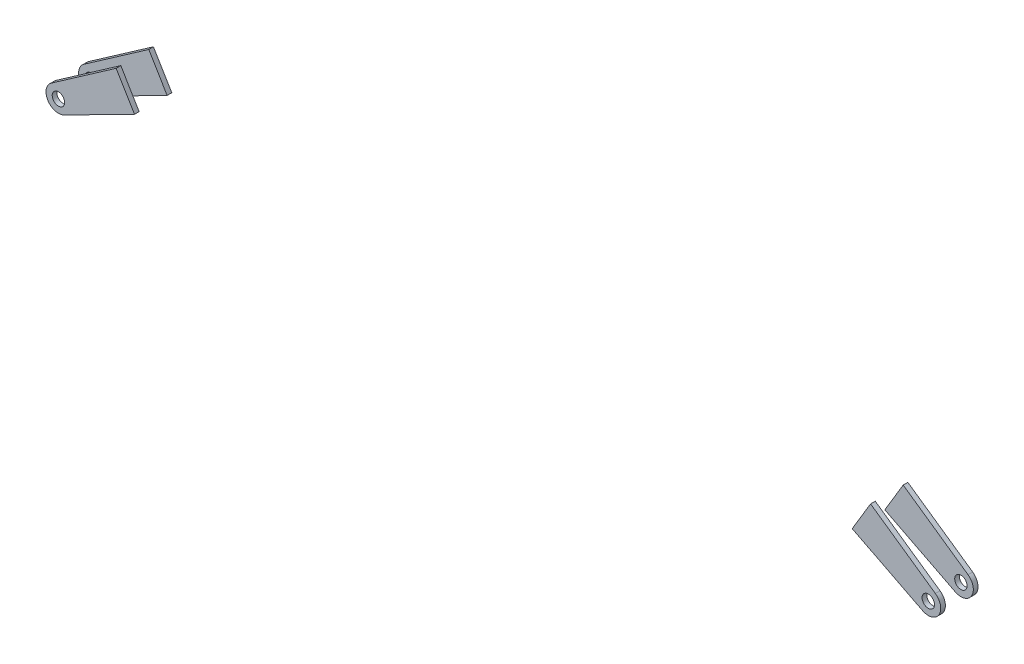
from build123d import *

# Parameters (mm, degrees)
BOSS_EXTRUDE1_START     = 306
BOSS_EXTRUDE1_OUTLINE_R = 4
BOSS_EXTRUDE1_DEPTH     = 3


# Read off the part's stored shape, not the designer's step: Boss-Extrude1
with BuildPart() as part:
    # Boss-Extrude1 outline → Boss-Extrude1 (new body)
    with BuildSketch(Plane.XY.offset(BOSS_EXTRUDE1_START)):
        with BuildLine():
            Line((242.843334981, -1944.327717242), (231.021017413, -1964.056701182))
            Line((231.021017413, -1964.056701182), (276.372336791, -1987.13022157))
            ThreePointArc((276.372336791, -1987.13022157), (286.862255284, -1984.112110459), (284.576864871, -1973.438574244))
            Line((284.576864871, -1973.438574244), (242.843334981, -1944.327717242))
        make_face()
        with Locations((280, -1980)):
            Circle(BOSS_EXTRUDE1_OUTLINE_R, mode=Mode.SUBTRACT)
    extrude(amount=BOSS_EXTRUDE1_DEPTH)


with BuildPart() as body_2:
    # Mirror1: mirrored copy
    add(part.part.mirror(Plane(origin=(0, 0, 297), x_dir=(1, 0, 0), z_dir=(0, 0, -1))))


with BuildPart() as body_3:
    # Mirror2: mirrored copy
    add(part.part.mirror(Plane(origin=(0, 0, 0), x_dir=(0, 0, 1), z_dir=(1, 0, 0))))


with BuildPart() as body_4:
    # Mirror2 2: mirrored copy
    add(body_2.part.mirror(Plane(origin=(0, 0, 0), x_dir=(0, 0, 1), z_dir=(1, 0, 0))))


solid = Compound([part.part, body_2.part, body_3.part, body_4.part])
